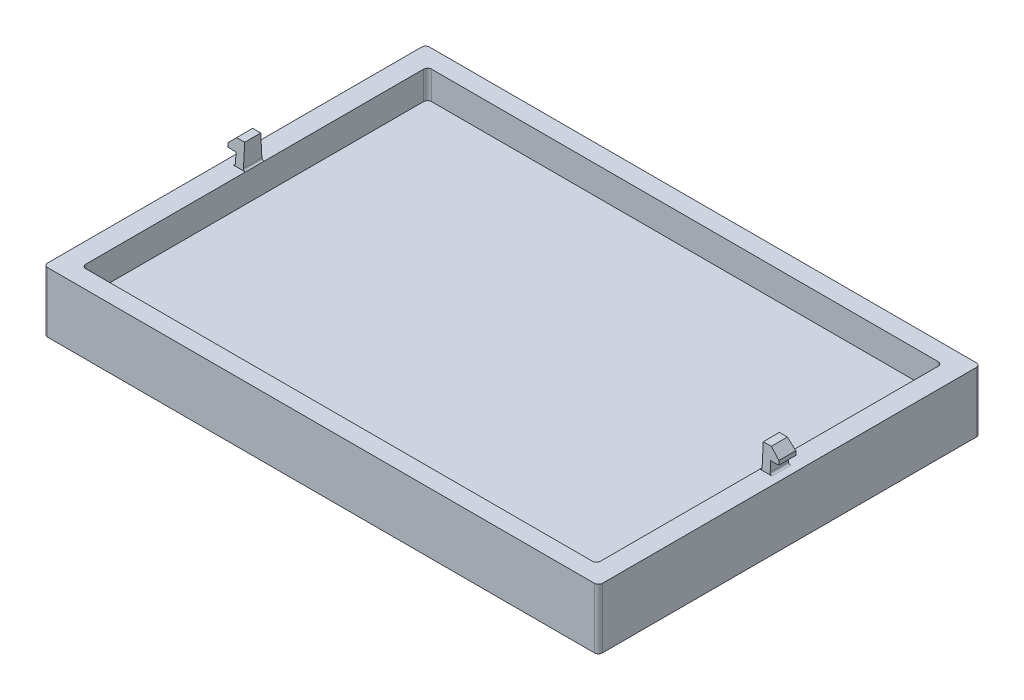
from build123d import *

# Parameters (mm, degrees)
SKETCH1_W           = 138
SKETCH1_H           = 95
BOSS_EXTRUDE1_DEPTH = 15
SKETCH2_W           = 128
SKETCH2_H           = 86
CUT_EXTRUDE1_DEPTH  = 7
SNAP_START          = 64.5
SNAP_HOOK2_DEPTH    = 2
SNAP_HOOK2_2_DEPTH  = 2
FILLET1_R           = 1
FILLET2_R           = 0.5


with BuildPart() as part:
    # Sketch1 → Boss-Extrude1 (new body)
    with BuildSketch(Plane(origin=(0, 0, 0), x_dir=(1, 0, 0), z_dir=(0, 1, 0))):
        Rectangle(SKETCH1_W, SKETCH1_H)
    extrude(amount=BOSS_EXTRUDE1_DEPTH)

    # Sketch2 → Cut-Extrude1 (cut)
    with BuildSketch(Plane(origin=(0, 15, 0), x_dir=(1, 0, 0), z_dir=(0, 1, 0))):
        Rectangle(SKETCH2_W, SKETCH2_H)
    extrude(amount=-CUT_EXTRUDE1_DEPTH, mode=Mode.SUBTRACT)



with BuildPart() as body_2:
    # Snap Hook2: read off the stored shape, not the designer's step
    # Snap Hook2 outline → Snap Hook2 (new body)
    with BuildSketch(Plane.YZ.offset(SNAP_START)):
        Polygon((21, -2), (21, 2), (18, 2.157223338), (18, -2.157223338), align=None)
    snap_hook2 = extrude(amount=SNAP_HOOK2_DEPTH)


with BuildPart() as part_1:
    add(part.part)

    add(body_2.part)  # Snap Hook2 2 merges body 2
    # Snap Hook2 2 outline → Snap Hook2 2 (add)
    with BuildSketch(Plane.YZ.offset(SNAP_START)):
        Polygon((18, -2.157223338), (18, 2.157223338), (15, 2.314446676), (15, -2.314446676), align=None)
    snap_hook2_2 = extrude(amount=SNAP_HOOK2_2_DEPTH)

    # Snap Hook2 3: loft between two sections, ruled curve by curve
    snap_hook2_3_from = [
        Edge.make_line((66.5, 21, -2), (66.5, 21, 2)),
        Edge.make_line((66.5, 18, 2.157223338), (66.5, 18, -2.157223338)),
        Edge.make_line((66.5, 18, 2.157223338), (66.5, 21, 2)),
        Edge.make_line((66.5, 18, -2.157223338), (66.5, 21, -2)),
    ]
    snap_hook2_3_to = [
        Edge.make_line((68.5, 19, -2.104815559), (68.5, 19, 2.104815559)),
        Edge.make_line((68.5, 18, 2.157223338), (68.5, 18, -2.157223338)),
        Edge.make_line((68.5, 18, 2.157223338), (68.5, 19, 2.104815559)),
        Edge.make_line((68.5, 18, -2.157223338), (68.5, 19, -2.104815559)),
    ]
    snap_hook2_3 = Solid(Shell([*[Face.make_surface_from_curves(snap_hook2_3_from[k], snap_hook2_3_to[k]) for k in range(4)], Face(Wire(snap_hook2_3_from)), Face(Wire(snap_hook2_3_to))]))
    add(snap_hook2_3)

    # Fillet1
    fillet1_edges = [part_1.edges().sort_by_distance(p)[0] for p in [
        (64, 11.5, -43),
        (64, 11.5, 43),
        (-64, 11.5, 43),
        (-64, 11.5, -43),
        (-69, 7.5, -47.5),
        (69, 7.5, -47.5),
        (69, 7.5, 47.5),
        (-69, 7.5, 47.5),
    ]]
    fillet(fillet1_edges, radius=FILLET1_R)

    # Mirror1: Snap Hook2, Snap Hook2 2, Snap Hook2 3 across plane
    add(snap_hook2.mirror(Plane(origin=(0, 0, 0), x_dir=(0, 0, 1), z_dir=(1, 0, 0))))
    add(snap_hook2_2.mirror(Plane(origin=(0, 0, 0), x_dir=(0, 0, 1), z_dir=(1, 0, 0))))
    add(snap_hook2_3.mirror(Plane(origin=(0, 0, 0), x_dir=(0, 0, 1), z_dir=(1, 0, 0))))

    # Fillet2
    fillet2_edges = [part_1.edges().sort_by_distance(p)[0] for p in [
        (66.5, 15, 0),
        (64.5, 15, 0),
        (-66.5, 15, 0),
        (-64.5, 15, 0),
    ]]
    fillet(fillet2_edges, radius=FILLET2_R - 0.0001)  # a hair under: the kernel refuses the full size


solid = part_1.part
